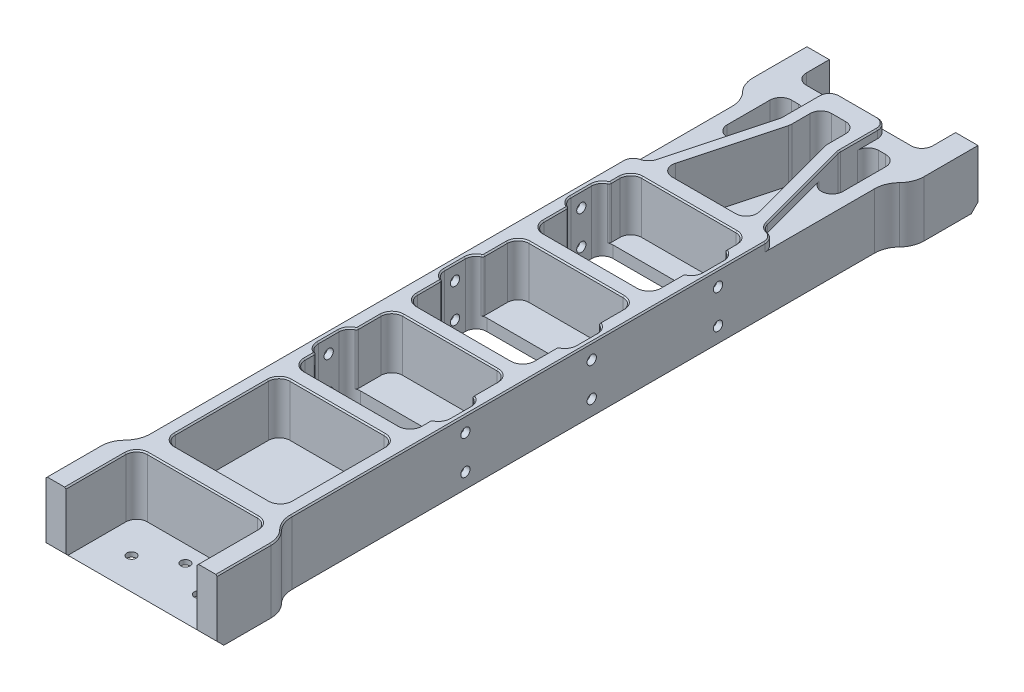
from build123d import *

# Parameters (mm, degrees)
BOSS_EXTRUDE1_DEPTH  = 225.8625
SKETCH2_W            = 68.6582
SKETCH2_H            = 12
BOSS_EXTRUDE2_DEPTH  = 31.1
BOSS_EXTRUDE3_DEPTH  = 38.1
M5_CLEARANCE_HOLE1_D = 5.5
SKETCH6_W            = 78
SKETCH6_H            = 42
CUT_EXTRUDE2_DEPTH   = 35.35
M5_CLEARANCE_HOLE2_D = 5.5
CUT_EXTRUDE3_DEPTH   = 235.614568821
SKETCH11_W           = 75
SKETCH11_H           = 20
CUT_EXTRUDE4_DEPTH   = 31.1
FILLET3_R            = 1.5
SKETCH12_W           = 68.6582
SKETCH12_H           = 9
BOSS_EXTRUDE4_DEPTH  = 31.1
BOSS_EXTRUDE6_DEPTH  = 31.1
FILLET4_R            = 6.35
CUT_EXTRUDE5_START   = -5
CUT_EXTRUDE5_DEPTH   = 5
FILLET5_R            = 6.35
FILLET6_R            = 6.35
CHAMFER1_SIZE        = 0.75
CHAMFER2_SIZE        = 4


with BuildPart() as part:
    # Sketch1 → Boss-Extrude1 (new, symmetric)
    with BuildSketch(Plane.XY):
        Polygon((-34.3291, 38.1), (-34.3291, 7), (34.3291, 7), (34.3291, 38.1), (42.3291, 38.1), (42.3291, 0), (-42.3291, 0), (-42.3291, 38.1), align=None)
    extrude(amount=BOSS_EXTRUDE1_DEPTH, both=True)

    # Sketch2 → Boss-Extrude2 (add)
    with BuildSketch(Plane(origin=(0, 7, 0), x_dir=(1, 0, 0), z_dir=(0, 1, 0))):
        with Locations((0, -177.8625)):
            Rectangle(SKETCH2_W, SKETCH2_H)
        with Locations((0, 199.8625)):
            Rectangle(SKETCH2_W, SKETCH2_H)
    extrude(amount=BOSS_EXTRUDE2_DEPTH)

    # Sketch7 → Boss-Extrude3 (add)
    with BuildSketch(Plane.XZ):
        with BuildLine():
            ThreePointArc((-46.5541, 183.427013667), (-43.425413439, 178.620692459), (-42.3291, 172.991527335))
            Line((-42.3291, 172.991527335), (-42.3291, 225.8625))
            Line((-42.3291, 225.8625), (-50.7791, 225.8625))
            Line((-50.7791, 225.8625), (-50.7791, 193.8625))
            ThreePointArc((-50.7791, 193.8625), (-49.682786561, 188.233334875), (-46.5541, 183.427013667))
        make_face()
        with BuildLine():
            Line((42.3291, 225.8625), (42.3291, 172.991527335))
            ThreePointArc((42.3291, 172.991527335), (43.425413439, 178.620692459), (46.5541, 183.427013667))
            ThreePointArc((46.5541, 183.427013667), (49.682786561, 188.233334875), (50.7791, 193.8625))
            Line((50.7791, 193.8625), (50.7791, 225.8625))
            Line((50.7791, 225.8625), (42.3291, 225.8625))
        make_face()
        with BuildLine():
            Line((-42.3291, -225.8625), (-42.3291, -172.991527335))
            ThreePointArc((-42.3291, -172.991527335), (-43.425413439, -178.620692459), (-46.5541, -183.427013667))
            ThreePointArc((-46.5541, -183.427013667), (-49.682786561, -188.233334875), (-50.7791, -193.8625))
            Line((-50.7791, -193.8625), (-50.7791, -225.8625))
            Line((-50.7791, -225.8625), (-42.3291, -225.8625))
        make_face()
        with BuildLine():
            ThreePointArc((46.5541, -183.427013667), (43.425413439, -178.620692459), (42.3291, -172.991527335))
            Line((42.3291, -172.991527335), (42.3291, -225.8625))
            Line((42.3291, -225.8625), (50.7791, -225.8625))
            Line((50.7791, -225.8625), (50.7791, -193.8625))
            ThreePointArc((50.7791, -193.8625), (49.682786561, -188.233334875), (46.5541, -183.427013667))
        make_face()
    extrude(amount=-BOSS_EXTRUDE3_DEPTH)

    # M5 Clearance Hole1 (through all)
    with Locations(Plane(origin=(0, 7, 0), x_dir=(1, 0, 0), z_dir=(0, 1, 0))):
        with Locations((-28, 213.8625), (0, 213.8625), (28, 213.8625), (0, -193.8625), (-20, -205.8625), (20, -205.8625)):
            Hole(M5_CLEARANCE_HOLE1_D / 2)

    # Sketch6 → Cut-Extrude2 (cut)
    with BuildSketch(Plane(origin=(0, 38.1, 0), x_dir=(1, 0, 0), z_dir=(0, 1, 0))):
        with Locations((0, -204.8625)):
            Rectangle(SKETCH6_W, SKETCH6_H)
    extrude(amount=-CUT_EXTRUDE2_DEPTH, mode=Mode.SUBTRACT)

    # M5 Clearance Hole2 (through all)
    with Locations(Plane(origin=(42.3291, 0, 0), x_dir=(0, 0, -1), z_dir=(1, 0, 0))):
        with Locations((-70, 29.1), (-70, 9), (5, 29.1), (5, 9), (80, 9), (80, 29.1)):
            Hole(M5_CLEARANCE_HOLE2_D / 2)

    # Sketch10 → Cut-Extrude3 (cut, through all)
    with BuildSketch(Plane(origin=(0, 38.1, 0), x_dir=(1, 0, 0), z_dir=(0, 1, 0))):
        with BuildLine():
            Line((-32.4791, 92.5), (32.4791, 92.5))
            ThreePointArc((32.4791, 92.5), (36.969228061, 90.640128061), (38.8291, 86.15))
            Line((38.8291, 86.15), (38.8291, 73.85))
            ThreePointArc((38.8291, 73.85), (36.969228061, 69.359871939), (32.4791, 67.5))
            Line((32.4791, 67.5), (-32.4791, 67.5))
            ThreePointArc((-32.4791, 67.5), (-36.969228061, 69.359871939), (-38.8291, 73.85))
            Line((-38.8291, 73.85), (-38.8291, 86.15))
            ThreePointArc((-38.8291, 86.15), (-36.969228061, 90.640128061), (-32.4791, 92.5))
        make_face()
        with BuildLine():
            Line((-32.4791, 17.5), (32.4791, 17.5))
            ThreePointArc((32.4791, 17.5), (36.969228061, 15.640128061), (38.8291, 11.15))
            Line((38.8291, 11.15), (38.8291, -1.15))
            ThreePointArc((38.8291, -1.15), (36.969228061, -5.640128061), (32.4791, -7.5))
            Line((32.4791, -7.5), (-32.4791, -7.5))
            ThreePointArc((-32.4791, -7.5), (-36.969228061, -5.640128061), (-38.8291, -1.15))
            Line((-38.8291, -1.15), (-38.8291, 11.15))
            ThreePointArc((-38.8291, 11.15), (-36.969228061, 15.640128061), (-32.4791, 17.5))
        make_face()
        with BuildLine():
            Line((-38.8291, -76.15), (-38.8291, -63.85))
            ThreePointArc((-38.8291, -63.85), (-36.969228061, -59.359871939), (-32.4791, -57.5))
            Line((-32.4791, -57.5), (32.4791, -57.5))
            ThreePointArc((32.4791, -57.5), (36.969228061, -59.359871939), (38.8291, -63.85))
            Line((38.8291, -63.85), (38.8291, -76.15))
            ThreePointArc((38.8291, -76.15), (36.969228061, -80.640128061), (32.4791, -82.5))
            Line((32.4791, -82.5), (-32.4791, -82.5))
            ThreePointArc((-32.4791, -82.5), (-36.969228061, -80.640128061), (-38.8291, -76.15))
        make_face()
    extrude(amount=-CUT_EXTRUDE3_DEPTH, mode=Mode.SUBTRACT)

    # Sketch11 → Cut-Extrude4 (cut)
    with BuildSketch(Plane(origin=(0, 38.1, 0), x_dir=(1, 0, 0), z_dir=(0, 1, 0))):
        with Locations((0, 215.8625)):
            Rectangle(SKETCH11_W, SKETCH11_H)
    extrude(amount=-CUT_EXTRUDE4_DEPTH, mode=Mode.SUBTRACT)

    # Fillet3
    fillet3_edges = [part.edges().sort_by_distance(p)[0] for p in [
        (34.3291, 22.55, 7.224537019),
        (-34.3291, 22.55, 7.224537019),
        (-34.3291, 22.55, -17.224537019),
        (34.3291, 22.55, -17.224537019),
        (34.3291, 22.55, -67.775462981),
        (-34.3291, 22.55, -67.775462981),
        (-34.3291, 22.55, -92.224537019),
        (34.3291, 22.55, -92.224537019),
        (34.3291, 22.55, 82.224537019),
        (-34.3291, 22.55, 82.224537019),
        (-34.3291, 22.55, 57.775462981),
        (34.3291, 22.55, 57.775462981),
    ]]
    fillet(fillet3_edges, radius=FILLET3_R)

    # Sketch12 → Boss-Extrude4 (add)
    with BuildSketch(Plane(origin=(0, 38.1, 0), x_dir=(1, 0, 0), z_dir=(0, 1, 0))):
        with Locations((0, 42.5)):
            Rectangle(SKETCH12_W, SKETCH12_H)
        with Locations((0, 109.3625)):
            Rectangle(SKETCH12_W, SKETCH12_H)
        with Locations((0, -99.3625)):
            Rectangle(SKETCH12_W, SKETCH12_H)
        with Locations((0, -32.5)):
            Rectangle(SKETCH12_W, SKETCH12_H)
    extrude(amount=-BOSS_EXTRUDE4_DEPTH)

    # Sketch16 → Boss-Extrude6 (add)
    with BuildSketch(Plane(origin=(0, 38.1, 0), x_dir=(1, 0, 0), z_dir=(0, 1, 0))):
        Polygon((-10.5, 193.8625), (-17.5, 193.8625), (-17.5, 176.669556246), (-34.3291, 113.8625), (-27.082166737, 113.8625), (-10.5, 175.747988763), align=None)
        Polygon((17.5, 193.8625), (10.5, 193.8625), (10.5, 175.747988763), (27.082166737, 113.8625), (34.3291, 113.8625), (17.5, 176.669556246), align=None)
    extrude(amount=-BOSS_EXTRUDE6_DEPTH)

    # Fillet4
    fillet4_edges = [part.edges().sort_by_distance(p)[0] for p in [
        (-34.3291, 22.55, -193.8625),
        (34.3291, 22.55, -193.8625),
        (34.3291, 22.55, -47),
        (34.3291, 22.55, -38),
        (-34.3291, 22.55, -38),
        (-34.3291, 22.55, -47),
        (-34.3291, 22.55, -104.8625),
        (34.3291, 22.55, -104.8625),
        (34.3291, 22.55, -113.8625),
        (-34.3291, 22.55, -113.8625),
        (-34.3291, 22.55, 94.8625),
        (-34.3291, 22.55, 103.8625),
        (34.3291, 22.55, 103.8625),
        (34.3291, 22.55, 94.8625),
        (34.3291, 22.55, 37),
        (34.3291, 22.55, 28),
        (-34.3291, 22.55, 28),
        (-34.3291, 22.55, 37),
        (-10.5, 22.55, -175.747988763),
        (-10.5, 22.55, -193.8625),
        (-17.5, 22.55, -193.8625),
        (-17.5, 22.55, -176.669556246),
        (-27.082166737, 22.55, -113.8625),
        (17.5, 22.55, -176.669556246),
        (17.5, 22.55, -193.8625),
        (10.5, 22.55, -193.8625),
        (10.5, 22.55, -175.747988763),
        (27.082166737, 22.55, -113.8625),
    ]]
    fillet(fillet4_edges, radius=FILLET4_R)

    # Sketch17 → Cut-Extrude5 (cut)
    with BuildSketch(Plane(origin=(0, 38.1, 0), x_dir=(1, 0, 0), z_dir=(0, 1, 0)).offset(CUT_EXTRUDE5_START)):
        with BuildLine():
            Line((-17.5, 187.5125), (-17.5, 205.8625))
            Line((-17.5, 205.8625), (-37.5, 205.8625))
            Line((-37.5, 205.8625), (-37.5, 225.8625))
            Line((-37.5, 225.8625), (-50.7791, 225.8625))
            Line((-50.7791, 225.8625), (-50.7791, 193.8625))
            ThreePointArc((-50.7791, 193.8625), (-49.682786561, 188.233334875), (-46.5541, 183.427013667))
            ThreePointArc((-46.5541, 183.427013667), (-43.425413439, 178.620692459), (-42.3291, 172.991527335))
            Line((-42.3291, 172.991527335), (-42.3291, 113.8625))
            Line((-42.3291, 113.8625), (-34.3291, 113.8625))
            Line((-34.3291, 113.8625), (-21.845471003, 160.452037679))
            ThreePointArc((-21.845471003, 160.452037679), (-28.807941321, 155.799863746), (-34.3291, 162.095538616))
            Line((-34.3291, 162.095538616), (-34.3291, 187.5125))
            ThreePointArc((-34.3291, 187.5125), (-32.469228061, 192.002628061), (-27.9791, 193.8625))
            Line((-27.9791, 193.8625), (-23.85, 193.8625))
            ThreePointArc((-23.85, 193.8625), (-19.359871939, 192.002628061), (-17.5, 187.5125))
        make_face()
        with BuildLine():
            Line((37.5, 205.8625), (17.5, 205.8625))
            Line((17.5, 205.8625), (17.5, 187.5125))
            ThreePointArc((17.5, 187.5125), (19.359871939, 192.002628061), (23.85, 193.8625))
            Line((23.85, 193.8625), (27.9791, 193.8625))
            ThreePointArc((27.9791, 193.8625), (32.469228061, 192.002628061), (34.3291, 187.5125))
            Line((34.3291, 187.5125), (34.3291, 162.095538616))
            ThreePointArc((34.3291, 162.095538616), (28.807941321, 155.799863746), (21.845471003, 160.452037679))
            Line((21.845471003, 160.452037679), (34.3291, 113.8625))
            Line((34.3291, 113.8625), (42.3291, 113.8625))
            Line((42.3291, 113.8625), (42.3291, 172.991527335))
            ThreePointArc((42.3291, 172.991527335), (43.425413439, 178.620692459), (46.5541, 183.427013667))
            ThreePointArc((46.5541, 183.427013667), (49.682786561, 188.233334875), (50.7791, 193.8625))
            Line((50.7791, 193.8625), (50.7791, 225.8625))
            Line((50.7791, 225.8625), (37.5, 225.8625))
            Line((37.5, 225.8625), (37.5, 205.8625))
        make_face()
    extrude(amount=CUT_EXTRUDE5_DEPTH, mode=Mode.SUBTRACT)

    # Fillet5
    fillet5_edges = [part.edges().sort_by_distance(p)[0] for p in [
        (-39, 20.425, 183.8625),
        (39, 20.425, 183.8625),
        (-34.3291, 22.55, 171.8625),
        (34.3291, 22.55, 171.8625),
        (37.5, 20.05, -205.8625),
        (-37.5, 20.05, -205.8625),
        (-34.3291, 35.6, -113.8625),
        (34.3291, 35.6, -113.8625),
    ]]
    fillet(fillet5_edges, radius=FILLET5_R)

    # Fillet6
    # the kernel refuses this fillet: 6.35 mm, written as the material it takes off along each edge
    with BuildSketch(Plane(origin=(17.5, 33.1, -205.8625), x_dir=(-1, 0, 0), z_dir=(0, 1, 0)), Plane(origin=(-17.5, 33.1, -205.8625), x_dir=(0, 0, 1), z_dir=(0, 1, 0))) as fillet6_piece_1:
        with BuildLine():
            CenterArc((FILLET6_R, FILLET6_R), FILLET6_R, 180, 90)
            Line((0, FILLET6_R), (0, 0))
            Line((0, 0), (FILLET6_R, 0))
        make_face()
    extrude(amount=20.875, mode=Mode.SUBTRACT)
    with BuildSketch(Plane(origin=(-42.3291, 33.1, -113.8625), x_dir=(0.9990396962687517, 0, -0.04381421321032847), z_dir=(0, 1, 0))) as fillet6_piece_2:
        with BuildLine():
            CenterArc((6.083893072, -6.206874275), FILLET6_R, 102.187896019, 75.300930601)
            Line((-0.260008999, -5.928654021), (-0.894399206, -5.900831996))
            Line((-0.894399206, -5.900831996), (-0.634390207, 0.027822025))
            Line((-0.634390207, 0.027822025), (0.027822025, 0.634390207))
            ThreePointArc((0.027822025, 0.634390207), (3.152292327, 0.497362411), (4.609231688, 0.620687428))
            Line((4.609231688, 0.620687428), (4.743291814, 0))
        make_face()
    extrude(amount=19.835882006, mode=Mode.SUBTRACT)
    with BuildSketch(Plane(origin=(42.3291, 33.1, -113.8625), x_dir=(-0.9990396962687521, 0, -0.04381421321032249), z_dir=(0, 1, 0))) as fillet6_piece_3:
        with BuildLine():
            CenterArc((6.083893072, 6.206874275), FILLET6_R, 182.511173381, 75.300930601)
            Line((-0.260008999, 5.928654021), (-0.894399206, 5.900831996))
            Line((-0.894399206, 5.900831996), (-0.634390207, -0.027822025))
            Line((-0.634390207, -0.027822025), (0.027822025, -0.634390207))
            ThreePointArc((0.027822025, -0.634390207), (3.152292327, -0.497362411), (4.609231688, -0.620687428))
            Line((4.609231688, -0.620687428), (4.743291814, 0))
        make_face()
    extrude(amount=19.835882006, mode=Mode.SUBTRACT)

    # Chamfer1
    chamfer1_edges = [part.edges().sort_by_distance(p)[0] for p in [
        (0, 38.1, 183.8625),
        (-25.39218419, 38.1, -147.215523866),
        (25.39218419, 38.1, -147.215523866),
        (0, 38.1, 171.8625),
        (34.3291, 38.1, 137.8625),
        (-34.3291, 38.1, 137.8625),
        (37.140128061, 38.1, 185.722371939),
        (-37.140128061, 38.1, 185.722371939),
        (-34.723305375, 38.1, -115.710595844),
        (32.469228061, 38.1, 170.002628061),
        (-32.469228061, 38.1, 170.002628061),
        (17.5, 38.1, -188.509024803),
        (34.723305375, 38.1, -115.710595844),
        (0, 38.1, -205.8625),
        (-17.5, 38.1, -188.509024803),
        (41.006724749, 38.1, -111.806998752),
        (-41.006724749, 38.1, -111.806998752),
        (-15.640128061, 38.1, -204.002628061),
        (15.640128061, 38.1, -204.002628061),
        (39, 38.1, 208.0375),
        (-39, 38.1, 208.0375),
        (38.8291, 38.1, -5),
        (-38.8291, 38.1, -5),
        (-37.842410129, 38.1, 4.549618281),
        (38.8291, 38.1, -80),
        (-38.8291, 38.1, -80),
        (-37.842410129, 38.1, -70.450381719),
        (38.8291, 38.1, 70),
        (-38.8291, 38.1, 70),
        (-37.842410129, 38.1, 60.450381719),
        (-37.842410129, 38.1, -89.549618281),
        (-37.842410129, 38.1, 79.549618281),
        (-34.3291, 38.1, 50.05035213),
        (-37.842410129, 38.1, -14.549618281),
        (-34.3291, 38.1, -24.94964787),
        (-34.3291, 38.1, -95.88089787),
        (34.3291, 38.1, -95.88089787),
        (37.842410129, 38.1, -89.549618281),
        (37.842410129, 38.1, -70.450381719),
        (34.3291, 38.1, -24.94964787),
        (37.842410129, 38.1, -14.549618281),
        (37.842410129, 38.1, 4.549618281),
        (34.3291, 38.1, 50.05035213),
        (37.842410129, 38.1, 60.450381719),
        (37.842410129, 38.1, 79.549618281),
        (34.562176347, 38.1, -92.446236303),
        (34.562176347, 38.1, -67.553763697),
        (34.562176347, 38.1, -17.446236303),
        (34.562176347, 38.1, 7.446236303),
        (34.562176347, 38.1, 57.553763697),
        (34.562176347, 38.1, 82.446236303),
        (-34.562176347, 38.1, 82.446236303),
        (-34.562176347, 38.1, 57.553763697),
        (-34.562176347, 38.1, 7.446236303),
        (-34.562176347, 38.1, -17.446236303),
        (-34.562176347, 38.1, -67.553763697),
        (-34.562176347, 38.1, -92.446236303),
        (-42.3291, 38.1, 32.531690068),
        (-43.425413439, 38.1, 178.620692459),
        (-50.7791, 38.1, 209.8625),
        (-49.682786561, 38.1, 188.233334875),
        (42.3291, 38.1, 32.531690068),
        (50.7791, 38.1, 209.8625),
        (49.682786561, 38.1, 188.233334875),
        (43.425413439, 38.1, 178.620692459),
        (0, 38.1, 37),
        (34.3291, 38.1, 85.88089787),
        (0, 38.1, 94.8625),
        (-34.3291, 38.1, 85.88089787),
        (0, 38.1, 28),
        (-34.3291, 38.1, 14.94964787),
        (0, 38.1, -38),
        (34.3291, 38.1, 14.94964787),
        (0, 38.1, -104.8625),
        (34.3291, 38.1, -60.05035213),
        (0, 38.1, -47),
        (-34.3291, 38.1, -60.05035213),
        (0, 38.1, 103.8625),
        (17.55432513, 38.1, -176.676708285),
        (-17.55432513, 38.1, -176.676708285),
        (32.469228061, 38.1, 93.002628061),
        (-32.469228061, 38.1, 93.002628061),
        (-32.469228061, 38.1, 105.722371939),
        (32.469228061, 38.1, 105.722371939),
        (-32.469228061, 38.1, -103.002628061),
        (32.469228061, 38.1, -103.002628061),
        (-32.469228061, 38.1, -48.859871939),
        (-32.469228061, 38.1, -36.140128061),
        (32.469228061, 38.1, -48.859871939),
        (32.469228061, 38.1, -36.140128061),
        (32.469228061, 38.1, 26.140128061),
        (32.469228061, 38.1, 38.859871939),
        (-32.469228061, 38.1, 26.140128061),
        (-32.469228061, 38.1, 38.859871939),
    ]]
    chamfer(chamfer1_edges, length=CHAMFER1_SIZE)

    # Chamfer2
    # the kernel refuses this chamfer: 4 mm, written as the material it takes off along each edge
    with BuildSketch(Plane(origin=(-61.065831952, 0, 225.8625), x_dir=(0, 0.9996219169112968, 0.02749587661058908), z_dir=(1, 0, 0))) as chamfer2_piece_1:
        Polygon((CHAMFER2_SIZE * 0.999621916911, -CHAMFER2_SIZE * 0.0274958766106), (-CHAMFER2_SIZE * 0.0274958766106, -CHAMFER2_SIZE * 0.999621916911), (0, 0), align=None)
    extrude(amount=122.131663904, mode=Mode.SUBTRACT)
    with BuildSketch(Plane(origin=(61.065831952, 0, -225.8625), x_dir=(0, -0.027495876610586292, 0.9996219169112968), z_dir=(-1, 0, 0))) as chamfer2_piece_2:
        Polygon((CHAMFER2_SIZE * 0.999621916911, CHAMFER2_SIZE * 0.0274958766106), (-CHAMFER2_SIZE * 0.0274958766106, CHAMFER2_SIZE * 0.999621916911), (0, 0), align=None)
    extrude(amount=122.131663904, mode=Mode.SUBTRACT)


solid = part.part
